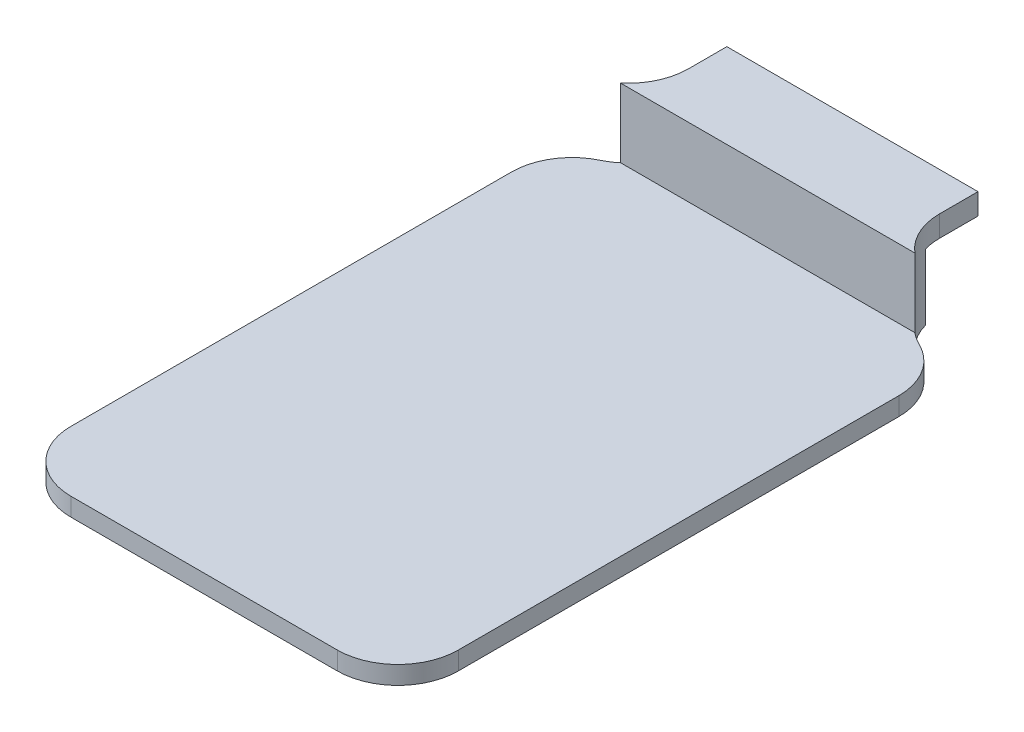
from build123d import *

# Parameters (mm, degrees)
SKETCH1_W           = 41.5
SKETCH1_H           = 92.8
BOSS_EXTRUDE1_DEPTH = 3
SKETCH2_W           = 5
SKETCH2_H           = 3.5
SKETCH2_H_2         = 7.9
SKETCH2_W_2         = 9
BOSS_EXTRUDE2_DEPTH = 41.5
SKETCH3_W           = 64.02
SKETCH3_H           = 92.8
BOSS_EXTRUDE3_DEPTH = 3
FILLET1_R           = 10
FILLET2_R           = 10


with BuildPart() as part:
    # Sketch1 → Boss-Extrude1 (new body)
    with BuildSketch(Plane(origin=(0, 0, 0), x_dir=(1, 0, 0), z_dir=(0, 1, 0))):
        with Locations((32.680302971, 6.528754522)):
            Rectangle(SKETCH1_W, SKETCH1_H)
    extrude(amount=BOSS_EXTRUDE1_DEPTH)

    # Sketch2 → Boss-Extrude2 (add)
    with BuildSketch(Plane(origin=(53.430302971, 0, 0), x_dir=(0, 0, -1), z_dir=(1, 0, 0))):
        with Locations((50.428754522, 12.65)):
            Rectangle(SKETCH2_W, SKETCH2_H)
        with Locations((50.428754522, 6.95)):
            Rectangle(SKETCH2_W, SKETCH2_H_2)
        with Locations((57.428754522, 12.65)):
            Rectangle(SKETCH2_W_2, SKETCH2_H)
    extrude(amount=-BOSS_EXTRUDE2_DEPTH)

    # Sketch3 → Boss-Extrude3 (add)
    with BuildSketch(Plane(origin=(0, 3, 0), x_dir=(1, 0, 0), z_dir=(0, 1, 0))):
        with Locations((32.680302971, 1.195086087)):
            Rectangle(SKETCH3_W, SKETCH3_H)
    extrude(amount=-BOSS_EXTRUDE3_DEPTH)

    # Fillet1
    fillet1_edges = [part.edges().sort_by_distance(p)[0] for p in [
        (0.670302971, 1.5, -47.595086087),
        (64.690302971, 1.5, -47.595086087),
        (64.690302971, 1.5, 45.204913913),
        (0.670302971, 1.5, 45.204913913),
    ]]
    fillet(fillet1_edges, radius=FILLET1_R)

    # Fillet2
    # the kernel refuses this fillet: 10 mm, written as the material it adds along each edge
    with BuildSketch(Plane(origin=(11.930302971, 22.973075278, -47.595086087), x_dir=(0, 0, -1), z_dir=(0, -1, 0))) as fillet2_piece_1_section:
        with BuildLine():
            CenterArc((7.989230111, -10), FILLET2_R, 90, 64.087374577)
            Line((-1.005384944, -5.63), (-1.90484645, -5.193))
            ThreePointArc((-1.90484645, -5.193), (-1, -1.26), (-1, 0))
            Line((-1, 0), (0, 1))
            Line((0, 1), (7.989230111, 1))
            Line((7.989230111, 1), (7.989230111, 0))
        make_face()
    fillet2_piece_1 = extrude(amount=22.973075278, mode=Mode.PRIVATE)
    fillet2_piece_1 = split(fillet2_piece_1, bisect_by=Plane(origin=(12.365804392, 12.65, -52.928754522), z_dir=(0, 0, -1)), keep=Keep.TOP, mode=Mode.PRIVATE)
    fillet2_piece_1 = split(fillet2_piece_1, bisect_by=Plane(origin=(12.365804392, 10.9, -54.185779558), z_dir=(0, 1, 0)), keep=Keep.TOP, mode=Mode.PRIVATE)
    fillet2_piece_1 = split(fillet2_piece_1, bisect_by=Plane(origin=(12.365804392, 14.4, -54.185779558), z_dir=(0, -1, 0)), keep=Keep.TOP, mode=Mode.PRIVATE)
    add(fillet2_piece_1)
    with BuildSketch(Plane(origin=(11.930302971, 22.973075278, -47.595086087), x_dir=(0, 0, -1), z_dir=(0, -1, 0))) as fillet2_piece_2_section:
        with BuildLine():
            CenterArc((7.989230111, -10), FILLET2_R, 90, 64.087374577)
            Line((-1.005384944, -5.63), (-1.90484645, -5.193))
            ThreePointArc((-1.90484645, -5.193), (-1, -1.26), (-1, 0))
            Line((-1, 0), (0, 1))
            Line((0, 1), (7.989230111, 1))
            Line((7.989230111, 1), (7.989230111, 0))
        make_face()
    fillet2_piece_2 = extrude(amount=22.973075278, mode=Mode.PRIVATE)
    fillet2_piece_2 = split(fillet2_piece_2, bisect_by=Plane(origin=(11.467639637, 12.65, -52.928754522), z_dir=(0, 0, 1)), keep=Keep.TOP, mode=Mode.PRIVATE)
    fillet2_piece_2 = split(fillet2_piece_2, bisect_by=Plane(origin=(11.467639637, 10.9, -49.92895082), z_dir=(0, 1, 0)), keep=Keep.TOP, mode=Mode.PRIVATE)
    fillet2_piece_2 = split(fillet2_piece_2, bisect_by=Plane(origin=(11.467639637, 14.4, -49.92895082), z_dir=(0, -1, 0)), keep=Keep.TOP, mode=Mode.PRIVATE)
    fillet2_piece_2 = split(fillet2_piece_2, bisect_by=Plane(origin=(11.467639637, 12.65, -47.928754522), z_dir=(0, 0, -1)), keep=Keep.TOP, mode=Mode.PRIVATE)
    add(fillet2_piece_2)
    with BuildSketch(Plane(origin=(11.930302971, 22.973075278, -47.595086087), x_dir=(0, 0, -1), z_dir=(0, -1, 0))) as fillet2_piece_3_section:
        with BuildLine():
            CenterArc((7.989230111, -10), FILLET2_R, 90, 64.087374577)
            Line((-1.005384944, -5.63), (-1.90484645, -5.193))
            ThreePointArc((-1.90484645, -5.193), (-1, -1.26), (-1, 0))
            Line((-1, 0), (0, 1))
            Line((0, 1), (7.989230111, 1))
            Line((7.989230111, 1), (7.989230111, 0))
        make_face()
    fillet2_piece_3 = extrude(amount=22.973075278, mode=Mode.PRIVATE)
    fillet2_piece_3 = split(fillet2_piece_3, bisect_by=Plane(origin=(11.467639637, 6.95, -52.928754522), z_dir=(0, 0, 1)), keep=Keep.TOP, mode=Mode.PRIVATE)
    fillet2_piece_3 = split(fillet2_piece_3, bisect_by=Plane(origin=(11.467639637, 10.9, -49.92895082), z_dir=(0, -1, 0)), keep=Keep.TOP, mode=Mode.PRIVATE)
    fillet2_piece_3 = split(fillet2_piece_3, bisect_by=Plane(origin=(11.467639637, 6.95, -47.928754522), z_dir=(0, 0, -1)), keep=Keep.TOP, mode=Mode.PRIVATE)
    fillet2_piece_3 = split(fillet2_piece_3, bisect_by=Plane(origin=(11.467639637, 3, -49.92895082), z_dir=(0, 1, 0)), keep=Keep.TOP, mode=Mode.PRIVATE)
    add(fillet2_piece_3)
    with BuildSketch(Plane(origin=(11.930302971, 3, -47.595086087), x_dir=(0, 0, -1), z_dir=(0, -1, 0))) as fillet2_piece_4_section:
        with BuildLine():
            CenterArc((7.989230111, -10), FILLET2_R, 90, 64.087374577)
            Line((-1.005384944, -5.63), (-1.90484645, -5.193))
            ThreePointArc((-1.90484645, -5.193), (-1, -1.26), (-1, 0))
            Line((-1, 0), (0, 1))
            Line((0, 1), (7.989230111, 1))
            Line((7.989230111, 1), (7.989230111, 0))
        make_face()
    fillet2_piece_4 = extrude(amount=3, mode=Mode.PRIVATE)
    fillet2_piece_4 = split(fillet2_piece_4, bisect_by=Plane(origin=(11.467639637, 1.5, -52.928754522), z_dir=(0, 0, 1)), keep=Keep.TOP, mode=Mode.PRIVATE)
    fillet2_piece_4 = split(fillet2_piece_4, bisect_by=Plane(origin=(11.467639637, 1.5, -47.928754522), z_dir=(0, 0, -1)), keep=Keep.TOP, mode=Mode.PRIVATE)
    add(fillet2_piece_4)
    with BuildSketch(Plane(origin=(11.930302971, 3, -47.595086087), x_dir=(0, 0, -1), z_dir=(0, -1, 0))) as fillet2_piece_5_section:
        with BuildLine():
            CenterArc((7.989230111, -10), FILLET2_R, 90, 64.087374577)
            Line((-1.005384944, -5.63), (-1.90484645, -5.193))
            ThreePointArc((-1.90484645, -5.193), (-1, -1.26), (-1, 0))
            Line((-1, 0), (0, 1))
            Line((0, 1), (7.989230111, 1))
            Line((7.989230111, 1), (7.989230111, 0))
        make_face()
    fillet2_piece_5 = extrude(amount=3, mode=Mode.PRIVATE)
    fillet2_piece_5 = split(fillet2_piece_5, bisect_by=Plane(origin=(9.548517713, 1.5, -47.928754522), z_dir=(0, 0, 1)), keep=Keep.TOP, mode=Mode.PRIVATE)
    add(fillet2_piece_5)
    with BuildSketch(Plane(origin=(53.430302971, 0, -47.595086087), x_dir=(0.9844267342530738, 0, 0.17579534944880632), z_dir=(0, 1, 0))) as fillet2_piece_6_section:
        with BuildLine():
            CenterArc((8.439797843, 9.622765202), FILLET2_R, 190.124945844, 64.087374577)
            Line((-1.404469499, 7.864811708), (-2.388896234, 7.689016358))
            Line((-2.388896234, 7.689016358), (-0.984426734, -0.175795349))
            Line((-0.984426734, -0.175795349), (0.175795349, -0.984426734))
            ThreePointArc((0.175795349, -0.984426734), (1.416173035, -0.762924594), (5.446991178, -0.96227652))
            Line((5.446991178, -0.96227652), (5.719064511, 0))
        make_face()
    fillet2_piece_6 = extrude(amount=3, mode=Mode.PRIVATE)
    fillet2_piece_6 = split(fillet2_piece_6, bisect_by=Plane(origin=(55.812088229, 1.5, -47.928754522), z_dir=(0, 0, 1)), keep=Keep.TOP, mode=Mode.PRIVATE)
    add(fillet2_piece_6)
    with BuildSketch(Plane(origin=(53.430302971, 0, -47.595086087), x_dir=(0.9844267342530738, 0, 0.17579534944880632), z_dir=(0, 1, 0))) as fillet2_piece_7_section:
        with BuildLine():
            CenterArc((8.439797843, 9.622765202), FILLET2_R, 190.124945844, 64.087374577)
            Line((-1.404469499, 7.864811708), (-2.388896234, 7.689016358))
            Line((-2.388896234, 7.689016358), (-0.984426734, -0.175795349))
            Line((-0.984426734, -0.175795349), (0.175795349, -0.984426734))
            ThreePointArc((0.175795349, -0.984426734), (1.416173035, -0.762924594), (5.446991178, -0.96227652))
            Line((5.446991178, -0.96227652), (5.719064511, 0))
        make_face()
    fillet2_piece_7 = extrude(amount=3, mode=Mode.PRIVATE)
    fillet2_piece_7 = split(fillet2_piece_7, bisect_by=Plane(origin=(53.892966305, 1.5, -52.928754522), z_dir=(0, 0, 1)), keep=Keep.TOP, mode=Mode.PRIVATE)
    fillet2_piece_7 = split(fillet2_piece_7, bisect_by=Plane(origin=(53.892966305, 1.5, -47.928754522), z_dir=(0, 0, -1)), keep=Keep.TOP, mode=Mode.PRIVATE)
    add(fillet2_piece_7)
    with BuildSketch(Plane(origin=(53.430302971, 0, -47.595086087), x_dir=(0.9844267342530738, 0, 0.17579534944880632), z_dir=(0, 1, 0))) as fillet2_piece_8_section:
        with BuildLine():
            CenterArc((8.439797843, 9.622765202), FILLET2_R, 190.124945844, 64.087374577)
            Line((-1.404469499, 7.864811708), (-2.388896234, 7.689016358))
            Line((-2.388896234, 7.689016358), (-0.984426734, -0.175795349))
            Line((-0.984426734, -0.175795349), (0.175795349, -0.984426734))
            ThreePointArc((0.175795349, -0.984426734), (1.416173035, -0.762924594), (5.446991178, -0.96227652))
            Line((5.446991178, -0.96227652), (5.719064511, 0))
        make_face()
    fillet2_piece_8 = extrude(amount=22.973075278, mode=Mode.PRIVATE)
    fillet2_piece_8 = split(fillet2_piece_8, bisect_by=Plane(origin=(53.892966305, 3, -49.92895082), z_dir=(0, 1, 0)), keep=Keep.TOP, mode=Mode.PRIVATE)
    fillet2_piece_8 = split(fillet2_piece_8, bisect_by=Plane(origin=(53.892966305, 6.95, -52.928754522), z_dir=(0, 0, 1)), keep=Keep.TOP, mode=Mode.PRIVATE)
    fillet2_piece_8 = split(fillet2_piece_8, bisect_by=Plane(origin=(53.892966305, 6.95, -47.928754522), z_dir=(0, 0, -1)), keep=Keep.TOP, mode=Mode.PRIVATE)
    fillet2_piece_8 = split(fillet2_piece_8, bisect_by=Plane(origin=(53.892966305, 10.9, -49.92895082), z_dir=(0, -1, 0)), keep=Keep.TOP, mode=Mode.PRIVATE)
    add(fillet2_piece_8)
    with BuildSketch(Plane(origin=(53.430302971, 0, -47.595086087), x_dir=(0.9844267342530738, 0, 0.17579534944880632), z_dir=(0, 1, 0))) as fillet2_piece_9_section:
        with BuildLine():
            CenterArc((8.439797843, 9.622765202), FILLET2_R, 190.124945844, 64.087374577)
            Line((-1.404469499, 7.864811708), (-2.388896234, 7.689016358))
            Line((-2.388896234, 7.689016358), (-0.984426734, -0.175795349))
            Line((-0.984426734, -0.175795349), (0.175795349, -0.984426734))
            ThreePointArc((0.175795349, -0.984426734), (1.416173035, -0.762924594), (5.446991178, -0.96227652))
            Line((5.446991178, -0.96227652), (5.719064511, 0))
        make_face()
    fillet2_piece_9 = extrude(amount=22.973075278, mode=Mode.PRIVATE)
    fillet2_piece_9 = split(fillet2_piece_9, bisect_by=Plane(origin=(53.892966305, 12.65, -52.928754522), z_dir=(0, 0, 1)), keep=Keep.TOP, mode=Mode.PRIVATE)
    fillet2_piece_9 = split(fillet2_piece_9, bisect_by=Plane(origin=(53.892966305, 12.65, -47.928754522), z_dir=(0, 0, -1)), keep=Keep.TOP, mode=Mode.PRIVATE)
    fillet2_piece_9 = split(fillet2_piece_9, bisect_by=Plane(origin=(53.892966305, 14.4, -49.92895082), z_dir=(0, -1, 0)), keep=Keep.TOP, mode=Mode.PRIVATE)
    fillet2_piece_9 = split(fillet2_piece_9, bisect_by=Plane(origin=(53.892966305, 10.9, -49.92895082), z_dir=(0, 1, 0)), keep=Keep.TOP, mode=Mode.PRIVATE)
    add(fillet2_piece_9)
    with BuildSketch(Plane(origin=(53.430302971, 0, -47.595086087), x_dir=(0.9844267342530738, 0, 0.17579534944880632), z_dir=(0, 1, 0))) as fillet2_piece_10_section:
        with BuildLine():
            CenterArc((8.439797843, 9.622765202), FILLET2_R, 190.124945844, 64.087374577)
            Line((-1.404469499, 7.864811708), (-2.388896234, 7.689016358))
            Line((-2.388896234, 7.689016358), (-0.984426734, -0.175795349))
            Line((-0.984426734, -0.175795349), (0.175795349, -0.984426734))
            ThreePointArc((0.175795349, -0.984426734), (1.416173035, -0.762924594), (5.446991178, -0.96227652))
            Line((5.446991178, -0.96227652), (5.719064511, 0))
        make_face()
    fillet2_piece_10 = extrude(amount=22.973075278, mode=Mode.PRIVATE)
    fillet2_piece_10 = split(fillet2_piece_10, bisect_by=Plane(origin=(52.99480155, 12.65, -52.928754522), z_dir=(0, 0, -1)), keep=Keep.TOP, mode=Mode.PRIVATE)
    fillet2_piece_10 = split(fillet2_piece_10, bisect_by=Plane(origin=(52.99480155, 14.4, -54.185779558), z_dir=(0, -1, 0)), keep=Keep.TOP, mode=Mode.PRIVATE)
    fillet2_piece_10 = split(fillet2_piece_10, bisect_by=Plane(origin=(52.99480155, 10.9, -54.185779558), z_dir=(0, 1, 0)), keep=Keep.TOP, mode=Mode.PRIVATE)
    add(fillet2_piece_10)


solid = part.part
